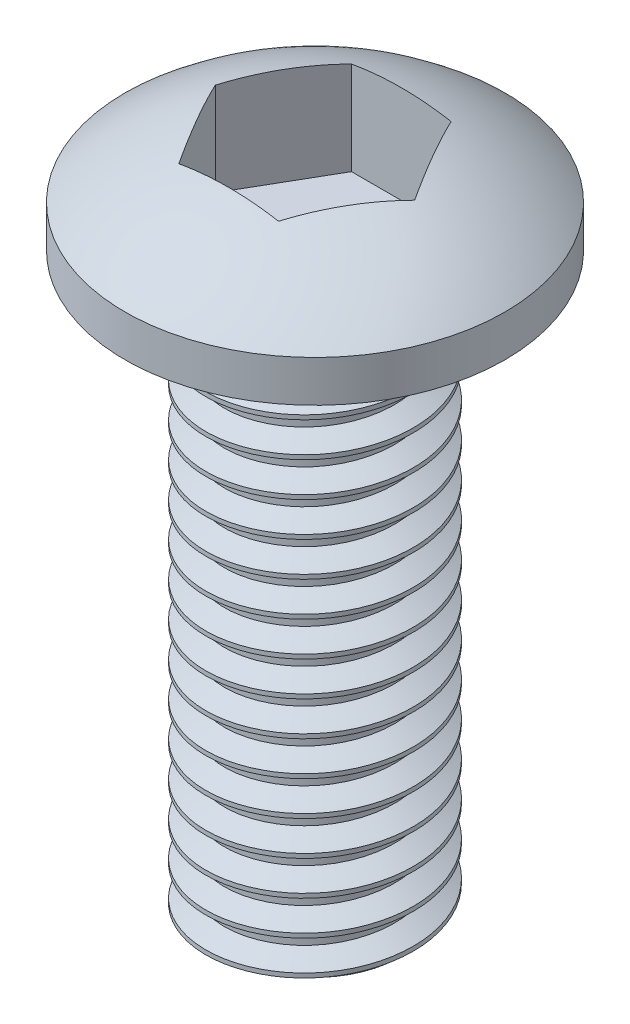
from build123d import *

# Parameters (mm, degrees)
CORTE_EXTRUS_O1_REACH      = 11.121
CORTE_EXTRUS_O1_END_RADIUS = 4.28125
ROSCA1_PITCH               = 0.5


with BuildPart() as part:
    # Esboço2 → Revolução1 (revolve)
    with BuildSketch(Plane.XY, mode=Mode.PRIVATE) as revolu_o1_sk:
        with BuildLine():
            Line((2.75, 0.6), (2.75, 0))
            Line((2.75, 0), (1.625, 0))
            Line((1.625, 0), (1.625, -0.25))
            Line((1.625, -0.25), (1.5, -0.25))
            Line((1.5, -0.25), (1.5, -8.25))
            Line((1.5, -8.25), (0, -8.25))
            Line((0, -8.25), (0, 1.6))
            ThreePointArc((0, 1.6), (1.463087489, 1.342240594), (2.75, 0.6))
        make_face()
    revolve(revolu_o1_sk.sketch.rotate(Axis((0, 79.08247191, 0), (0, -1, 0)), 180), axis=Axis((0, 79.08247191, 0), (0, -1, 0)))

    # Corte-extrusão1: up to this sphere (the profile starts inside it)
    corte_extrus_o1_end = Location((0, -2.68125, 0)) * Sphere(CORTE_EXTRUS_O1_END_RADIUS, mode=Mode.PRIVATE)
    # Esboço3 → Corte-extrusão1 (cut, up to the surface)
    with BuildSketch(Plane(origin=(0, 0, 0), x_dir=(1, 0, 0), z_dir=(0, 1, 0)), mode=Mode.PRIVATE) as corte_extrus_o1_sk1:
        Polygon((-1.443375673, 0), (-0.721687836, -1.25), (0.721687836, -1.25), (1.443375673, 0), (0.721687836, 1.25), (-0.721687836, 1.25), align=None)
    corte_extrus_o1_tool1 = extrude(corte_extrus_o1_sk1.sketch, amount=CORTE_EXTRUS_O1_REACH, mode=Mode.PRIVATE) & corte_extrus_o1_end
    add(corte_extrus_o1_tool1.solids().sort_by_distance((0, 0, 0))[0], mode=Mode.SUBTRACT)

    # Rosca1: the profile of Perfil da rosca1 profile screwed along a right-hand helix of 16 turns, 6 arcs to a turn; built about Z, then put on its axis
    rosca1_z = Axis((0, 0, 0), (0, 0, 1))
    rosca1_corners = [(1.5003, 0, -0.000173205), (1.5003, 0, 0.437673204), (1.229367063, 0, 0.281249999), (1.229367063, 0, 0.156249999)]
    with BuildLine(mode=Mode.PRIVATE) as rosca1_profile:
        Line(rosca1_corners[0], rosca1_corners[1])
        Line(rosca1_corners[1], rosca1_corners[2])
        Line(rosca1_corners[2], rosca1_corners[3])
        Line(rosca1_corners[3], rosca1_corners[0])
    rosca1_cap = Face(rosca1_profile.wire())
    rosca1_turn_angles = [0, 30, 60, 90, 120, 150, 180, 210, 240, 270, 300, 330, 360]
    rosca1_turn_weights = [1, 0.8660254037844387, 1, 0.8660254037844387, 1, 0.8660254037844387, 1, 0.8660254037844387, 1, 0.8660254037844387, 1, 0.8660254037844387, 1]
    rosca1_turn_rails = [Edge.make_bspline([Vector(p[0], p[1], 0).rotate(rosca1_z, rosca1_turn_angles[k]) / rosca1_turn_weights[k] + Vector(0, 0, p[2] + ROSCA1_PITCH * rosca1_turn_angles[k] / 360) for k in range(13)], [0, 0, 0, 1, 1, 2, 2, 3, 3, 4, 4, 5, 5, 6, 6, 6], 2, rosca1_turn_weights) for p in rosca1_corners]
    rosca1_turn_sides = [Face.make_surface_from_curves(rosca1_turn_rails[p[0]], rosca1_turn_rails[p[1]]) for p in [(0, 1), (1, 2), (2, 3), (3, 0)]]
    rosca1 = Plane(origin=(0, -0.25, 0), x_dir=(-1, 0, 0), z_dir=(0, -1, 0)) * Solid(Shell([*[p.moved(Location((0, 0, ROSCA1_PITCH * i))) for i in range(16) for p in rosca1_turn_sides], rosca1_cap, rosca1_cap.rotate(rosca1_z, 5760).moved(Location((0, 0, ROSCA1_PITCH * 5760 / 360)))]))
    add(rosca1, mode=Mode.SUBTRACT)


solid = part.part
